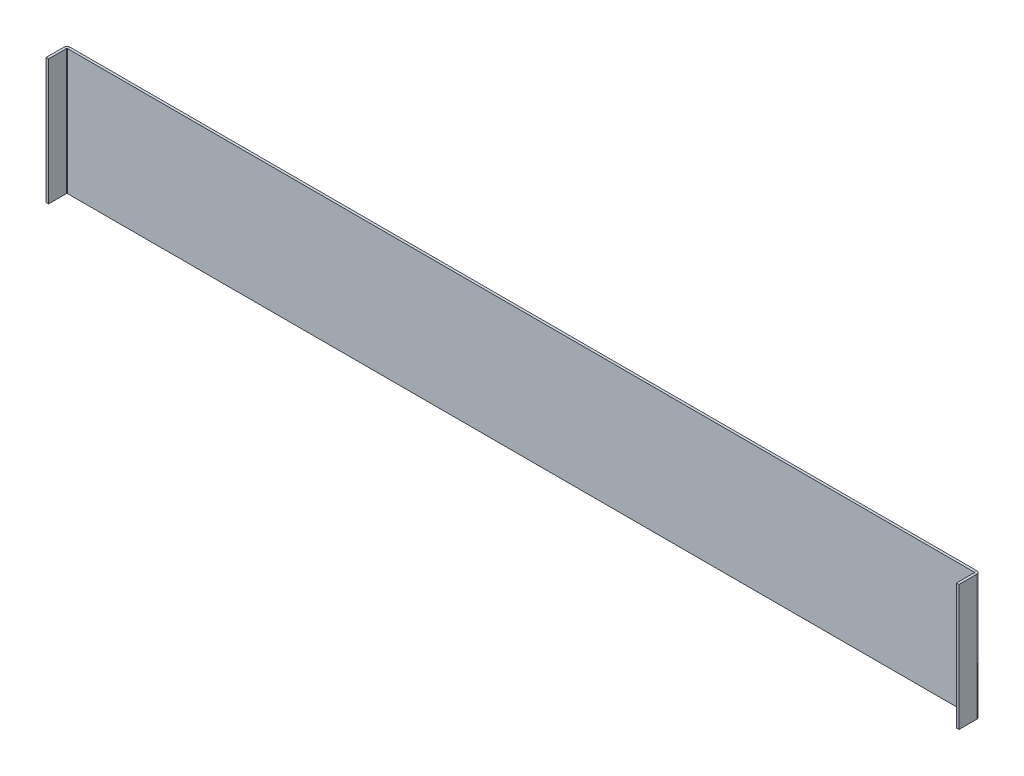
from build123d import *

# Parameters (mm, degrees)
SM_BASE_FLANGE_1_DEPTH = 75


# Sheet-metal steps are written as plain solids
with BuildPart() as part:
    # Sketch 1 → Базовая кромка1 (new, symmetric)
    with BuildSketch(Plane(origin=(0, 0, 0), x_dir=(1, 0, 0), z_dir=(0, 1, 0))):
        with BuildLine():
            Line((-545, 0), (-545, 21.25))
            ThreePointArc((-545, 21.25), (-543.901650429, 23.901650429), (-541.25, 25))
            Line((-541.25, 25), (541.25, 25))
            ThreePointArc((541.25, 25), (543.901650429, 23.901650429), (545, 21.25))
            Line((545, 21.25), (545, 0))
            Line((545, 0), (542, 0))
            Line((542, 0), (542, 21.25))
            ThreePointArc((542, 21.25), (541.780330086, 21.780330086), (541.25, 22))
            Line((541.25, 22), (-541.25, 22))
            ThreePointArc((-541.25, 22), (-541.780330086, 21.780330086), (-542, 21.25))
            Line((-542, 21.25), (-542, 0))
            Line((-542, 0), (-545, 0))
        make_face()
    extrude(amount=SM_BASE_FLANGE_1_DEPTH, both=True)


solid = part.part
